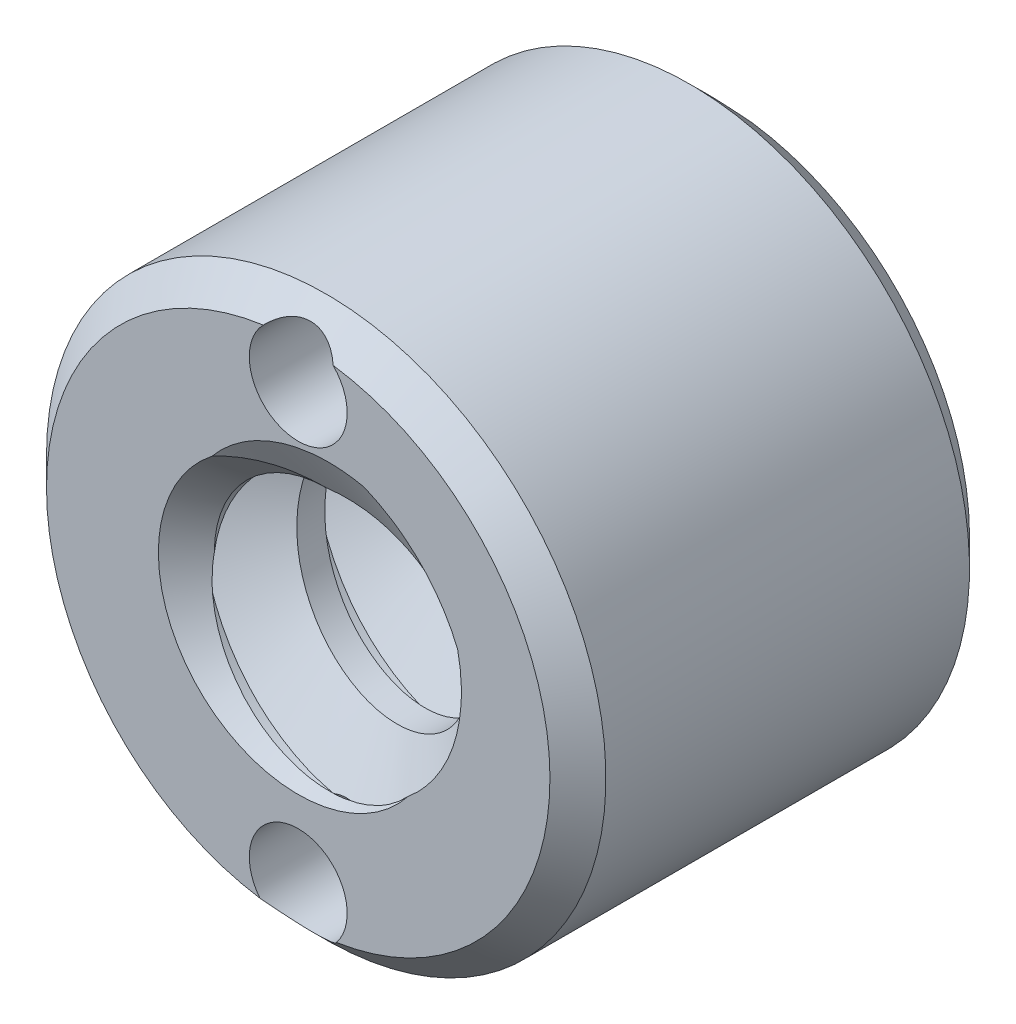
from build123d import *

# Parameters (mm, degrees)
SKETCH1_R           = 10
SKETCH1_R_2         = 4
SKETCH1_R_3         = 1.75
BOSS_EXTRUDE1_DEPTH = 15
CHAMFER3_SIZE       = 1
THREAD1_PITCH       = 4


with BuildPart() as part:
    # Sketch1 → Boss-Extrude1 (new body)
    with BuildSketch(Plane.XY):
        Circle(SKETCH1_R)
        Circle(SKETCH1_R_2, mode=Mode.SUBTRACT)
        with Locations((0, 7.688274808)):
            Circle(SKETCH1_R_3, mode=Mode.SUBTRACT)
        with Locations((0, -7.804984862)):
            Circle(SKETCH1_R_3, mode=Mode.SUBTRACT)
    extrude(amount=BOSS_EXTRUDE1_DEPTH)

    # Chamfer3
    # the kernel refuses this chamfer: 1 mm, written as the material it takes off along each edge
    with BuildSketch(Plane(origin=(0, 0, 0), x_dir=(1, 0, 0), z_dir=(0, -1, 0))) as chamfer3_piece_1:
        Polygon((10, CHAMFER3_SIZE), (10 - CHAMFER3_SIZE, 0), (10, 0), align=None)
    revolve(axis=Axis((0, 0, 0), (0, 0, 1)), mode=Mode.SUBTRACT)
    with BuildSketch(Plane(origin=(0, 0, 15), x_dir=(1, 0, 0), z_dir=(0, -1, 0))) as chamfer3_piece_2:
        Polygon((10, -CHAMFER3_SIZE), (10 - CHAMFER3_SIZE, 0), (10, 0), align=None)
    revolve(axis=Axis((0, 0, 15), (0, 0, 1)), mode=Mode.SUBTRACT)
    with BuildSketch(Plane(origin=(0, 0, 0), x_dir=(1, 0, 0), z_dir=(0, -1, 0))) as chamfer3_piece_3:
        Polygon((4, CHAMFER3_SIZE), (4 + CHAMFER3_SIZE, 0), (4, 0), align=None)
    revolve(axis=Axis((0, 0, 0), (0, 0, 1)), mode=Mode.SUBTRACT)
    with BuildSketch(Plane(origin=(0, 0, 15), x_dir=(1, 0, 0), z_dir=(0, -1, 0))) as chamfer3_piece_4:
        Polygon((4, -CHAMFER3_SIZE), (4 + CHAMFER3_SIZE, 0), (4, 0), align=None)
    revolve(axis=Axis((0, 0, 15), (0, 0, 1)), mode=Mode.SUBTRACT)

    # Thread1: the profile of Thread Profile1 profile screwed along a right-hand helix of 4.5 turns, 12 arcs to a turn; built about Z, then put on its axis
    thread1_z = Axis((0, 0, 0), (0, 0, 1))
    thread1_corners = [(3.9997, 0, -0.000173205), (6.1650635, 0, 1.249999995), (6.1650635, 0, 1.749999995), (3.9997, 0, 3.000173194)]
    with BuildLine(mode=Mode.PRIVATE) as thread1_profile:
        Line(thread1_corners[0], thread1_corners[1])
        Line(thread1_corners[1], thread1_corners[2])
        Line(thread1_corners[2], thread1_corners[3])
        Line(thread1_corners[3], thread1_corners[0])
    thread1_cap = Face(thread1_profile.wire())
    thread1_turn_angles = [0, 15, 30, 45, 60, 75, 90, 105, 120, 135, 150, 165, 180, 195, 210, 225, 240, 255, 270, 285, 300, 315, 330, 345, 360]
    thread1_turn_weights = [1, 0.9659258262890683, 1, 0.9659258262890683, 1, 0.9659258262890683, 1, 0.9659258262890683, 1, 0.9659258262890683, 1, 0.9659258262890683, 1, 0.9659258262890683, 1, 0.9659258262890683, 1, 0.9659258262890683, 1, 0.9659258262890683, 1, 0.9659258262890683, 1, 0.9659258262890683, 1]
    thread1_turn_rails = [Edge.make_bspline([Vector(p[0], p[1], 0).rotate(thread1_z, thread1_turn_angles[k]) / thread1_turn_weights[k] + Vector(0, 0, p[2] + THREAD1_PITCH * thread1_turn_angles[k] / 360) for k in range(25)], [0, 0, 0, 1, 1, 2, 2, 3, 3, 4, 4, 5, 5, 6, 6, 7, 7, 8, 8, 9, 9, 10, 10, 11, 11, 12, 12, 12], 2, thread1_turn_weights) for p in thread1_corners]
    thread1_turn_sides = [Face.make_surface_from_curves(thread1_turn_rails[p[0]], thread1_turn_rails[p[1]]) for p in [(0, 1), (1, 2), (2, 3), (3, 0)]]
    thread1_last_angles = [1440, 1455, 1470, 1485, 1500, 1515, 1530, 1545, 1560, 1575, 1590, 1605, 1620]
    thread1_last_weights = [1, 0.9659258262890683, 1, 0.9659258262890683, 1, 0.9659258262890683, 1, 0.9659258262890683, 1, 0.9659258262890683, 1, 0.9659258262890678, 1]
    thread1_last_rails = [Edge.make_bspline([Vector(p[0], p[1], 0).rotate(thread1_z, thread1_last_angles[k]) / thread1_last_weights[k] + Vector(0, 0, p[2] + THREAD1_PITCH * thread1_last_angles[k] / 360) for k in range(13)], [0, 0, 0, 1, 1, 2, 2, 3, 3, 4, 4, 5, 5, 6, 6, 6], 2, thread1_last_weights) for p in thread1_corners]
    thread1_last_sides = [Face.make_surface_from_curves(thread1_last_rails[p[0]], thread1_last_rails[p[1]]) for p in [(0, 1), (1, 2), (2, 3), (3, 0)]]
    thread1 = Plane(origin=(0, 0, 18), x_dir=(-1, 0, 0), z_dir=(0, 0, -1)) * Solid(Shell([*[p.moved(Location((0, 0, THREAD1_PITCH * i))) for i in range(4) for p in thread1_turn_sides], *thread1_last_sides, thread1_cap, thread1_cap.rotate(thread1_z, 1620).moved(Location((0, 0, THREAD1_PITCH * 1620 / 360)))]))
    add(thread1, mode=Mode.SUBTRACT)


solid = part.part
